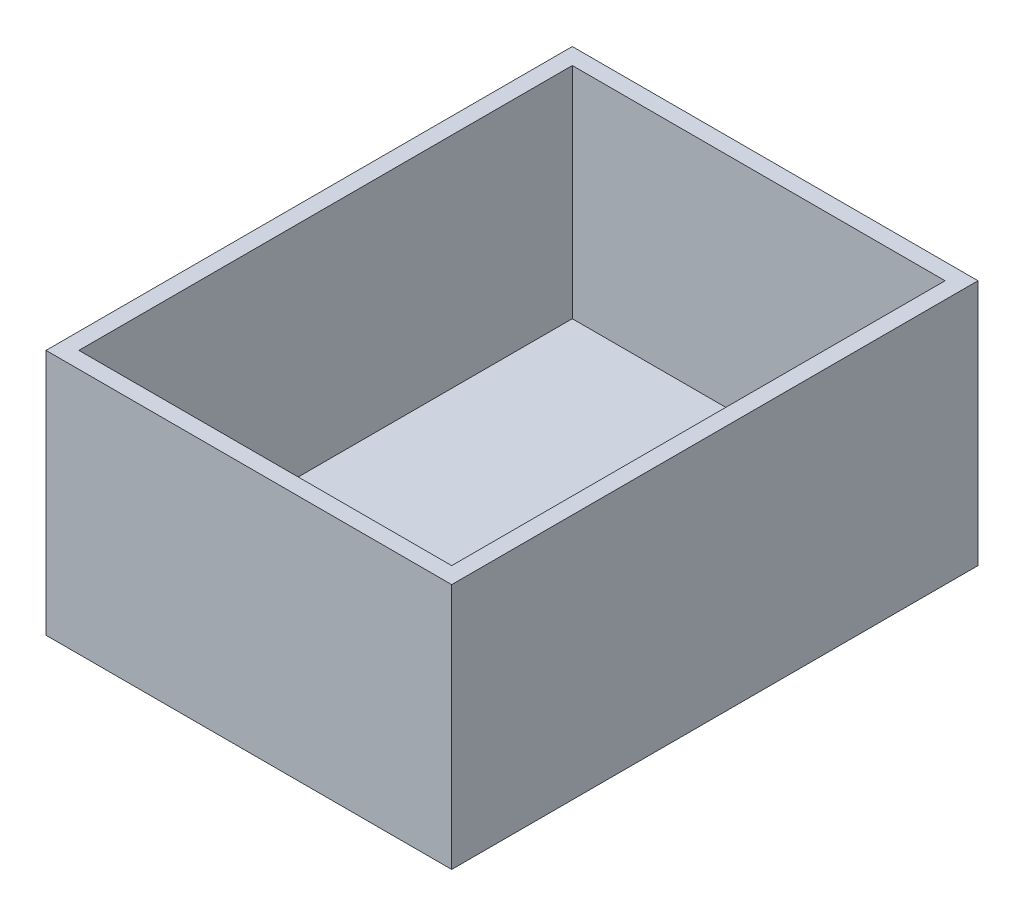
from build123d import *

# Parameters (mm, degrees)
SKETCH1_W           = 74
SKETCH1_H           = 96
BOSS_EXTRUDE1_DEPTH = 45
SKETCH2_W           = 68
SKETCH2_H           = 90
CUT_EXTRUDE1_DEPTH  = 40
SKETCH3_R           = 5
CUT_EXTRUDE2_DEPTH  = 10


with BuildPart() as part:
    # Sketch1 → Boss-Extrude1 (new body)
    with BuildSketch(Plane(origin=(0, 0, 0), x_dir=(1, 0, 0), z_dir=(0, 1, 0))):
        with Locations((37, -48)):
            Rectangle(SKETCH1_W, SKETCH1_H)
    extrude(amount=BOSS_EXTRUDE1_DEPTH)

    # Sketch2 → Cut-Extrude1 (cut)
    with BuildSketch(Plane(origin=(0, 45, 0), x_dir=(1, 0, 0), z_dir=(0, 1, 0))):
        with Locations((37, -48)):
            Rectangle(SKETCH2_W, SKETCH2_H)
    extrude(amount=-CUT_EXTRUDE1_DEPTH, mode=Mode.SUBTRACT)

    # Sketch3 → Cut-Extrude2 (cut)
    with BuildSketch(Plane.XZ):
        with Locations((64.4, 50)):
            Circle(SKETCH3_R)
    extrude(amount=-CUT_EXTRUDE2_DEPTH, mode=Mode.SUBTRACT)


solid = part.part
